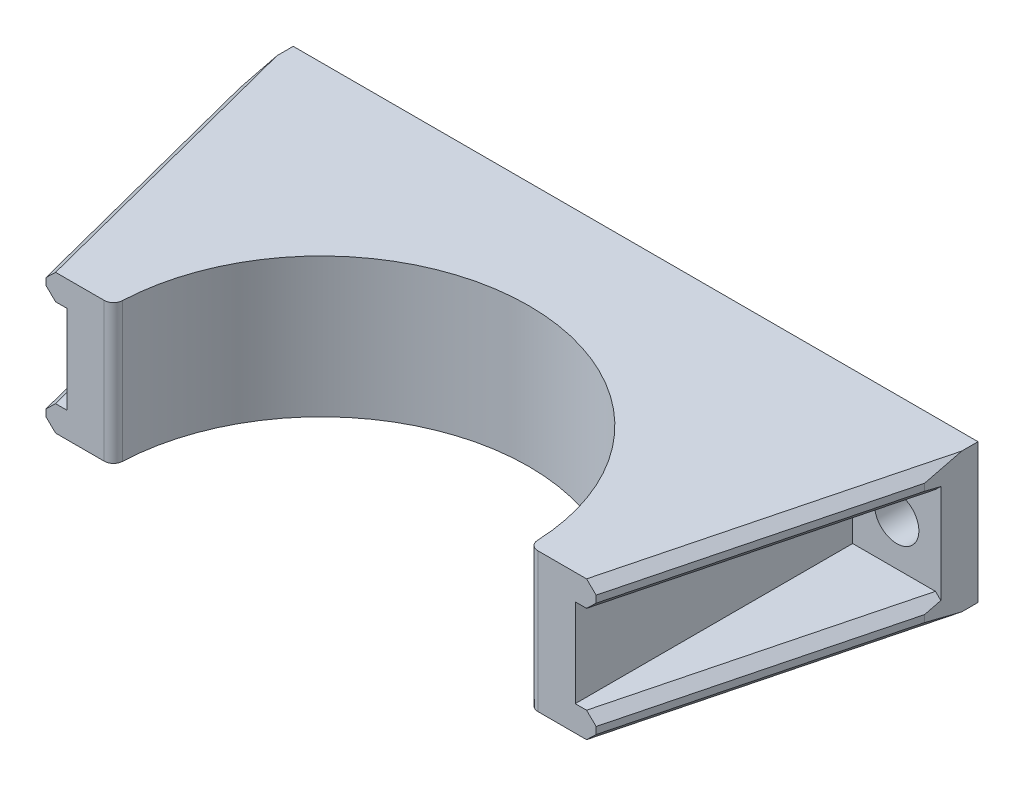
from build123d import *

# Parameters (mm, degrees)
BOSS_EXTRUDE1_DEPTH     = 30
CUT_EXTRUDE2_DEPTH      = 100.544588
CUT_EXTRUDE2_DEPTH_BACK = 100.544588
SKETCH8_R               = 4.7625
SKETCH9_W               = 19
SKETCH9_H               = 5.5
BOSS_EXTRUDE3_DEPTH     = 59.75
CUT_EXTRUDE3_DEPTH      = 98.483973042
CUT_EXTRUDE3_DEPTH_BACK = 98.483973042
CHAMFER4_SIZE           = 2
FILLET2_R               = 2


with BuildPart() as part:
    # Sketch1 → Boss-Extrude1 (new body)
    with BuildSketch(Plane(origin=(0, 0, 0), x_dir=(1, 0, 0), z_dir=(0, 1, 0))):
        with BuildLine():
            Line((-54.75, -11.5), (-54.75, -56.25))
            Line((-54.75, -56.25), (-44.75, -56.25))
            ThreePointArc((-44.75, -56.25), (0, -11.5), (44.75, -56.25))
            Line((44.75, -56.25), (54.75, -56.25))
            Line((54.75, -56.25), (54.75, -11.5))
            Line((54.75, -11.5), (54.75, 3.5))
            Line((54.75, 3.5), (73.75, 3.5))
            Line((73.75, 3.5), (73.75, 11.5))
            Line((73.75, 11.5), (54.75, 11.5))
            Line((54.75, 11.5), (-54.75, 11.5))
            Line((-54.75, 11.5), (-73.75, 11.5))
            Line((-73.75, 11.5), (-73.75, 3.5))
            Line((-73.75, 3.5), (-54.75, 3.5))
            Line((-54.75, 3.5), (-54.75, -11.5))
        make_face()
    extrude(amount=BOSS_EXTRUDE1_DEPTH)

    # Sketch8 → Cut-Extrude2 (cut, two sides: drawn at the far end of the back side and taken through both)
    with BuildSketch(Plane.XY.offset(-3.5).offset(-CUT_EXTRUDE2_DEPTH_BACK)):
        with Locations((-64.25, 15)):
            Circle(SKETCH8_R)
        with Locations((64.25, 15)):
            Circle(SKETCH8_R)
    extrude(amount=CUT_EXTRUDE2_DEPTH + CUT_EXTRUDE2_DEPTH_BACK, mode=Mode.SUBTRACT)

    # Sketch9 → Boss-Extrude3 (add)
    with BuildSketch(Plane.XY.offset(-3.5)):
        with Locations((-64.25, 27.25)):
            Rectangle(SKETCH9_W, SKETCH9_H)
        with Locations((-64.25, 2.75)):
            Rectangle(SKETCH9_W, SKETCH9_H)
        with Locations((64.25, 27.25)):
            Rectangle(SKETCH9_W, SKETCH9_H)
        with Locations((64.25, 2.75)):
            Rectangle(SKETCH9_W, SKETCH9_H)
    extrude(amount=BOSS_EXTRUDE3_DEPTH)

    # Sketch10 → Cut-Extrude3 (cut, two sides: drawn at the far end of the back side and taken through both)
    with BuildSketch(Plane(origin=(0, 30, 0), x_dir=(1, 0, 0), z_dir=(0, 1, 0)).offset(-CUT_EXTRUDE3_DEPTH_BACK)):
        Polygon((-59.25, -56.25), (-73.75, 0), (-73.75, -56.25), align=None)
        Polygon((73.75, -56.25), (59.25, -56.25), (73.75, 0), align=None)
    extrude(amount=CUT_EXTRUDE3_DEPTH + CUT_EXTRUDE3_DEPTH_BACK, mode=Mode.SUBTRACT)

    # Chamfer4
    chamfer4_edges = [part.edges().sort_by_distance(p)[0] for p in [
        (-66.5, 24.5, 28.125),
    ]]
    chamfer(chamfer4_edges, length=CHAMFER4_SIZE)
    chamfer4_2_edges = [part.edges().sort_by_distance(p)[0] for p in [
        (-66.5, 5.5, 28.125),
    ]]
    chamfer(chamfer4_2_edges, length=CHAMFER4_SIZE)
    chamfer4_3_edges = [part.edges().sort_by_distance(p)[0] for p in [
        (-66.5, 0, 28.125),
    ]]
    chamfer(chamfer4_3_edges, length=CHAMFER4_SIZE)
    chamfer4_4_edges = [part.edges().sort_by_distance(p)[0] for p in [
        (66.5, 0, 28.125),
    ]]
    chamfer(chamfer4_4_edges, length=CHAMFER4_SIZE)
    chamfer4_5_edges = [part.edges().sort_by_distance(p)[0] for p in [
        (-66.5, 30, 28.125),
    ]]
    chamfer(chamfer4_5_edges, length=CHAMFER4_SIZE)
    chamfer4_6_edges = [part.edges().sort_by_distance(p)[0] for p in [
        (66.5, 30, 28.125),
    ]]
    chamfer(chamfer4_6_edges, length=CHAMFER4_SIZE)
    chamfer4_7_edges = [part.edges().sort_by_distance(p)[0] for p in [
        (66.5, 5.5, 28.125),
    ]]
    chamfer(chamfer4_7_edges, length=CHAMFER4_SIZE)
    chamfer4_8_edges = [part.edges().sort_by_distance(p)[0] for p in [
        (66.5, 24.5, 28.125),
    ]]
    chamfer(chamfer4_8_edges, length=CHAMFER4_SIZE)

    # Fillet2
    fillet2_edges = [part.edges().sort_by_distance(p)[0] for p in [
        (44.75, 15, 56.25),
        (-44.75, 15, 56.25),
    ]]
    fillet(fillet2_edges, radius=FILLET2_R)


solid = part.part
